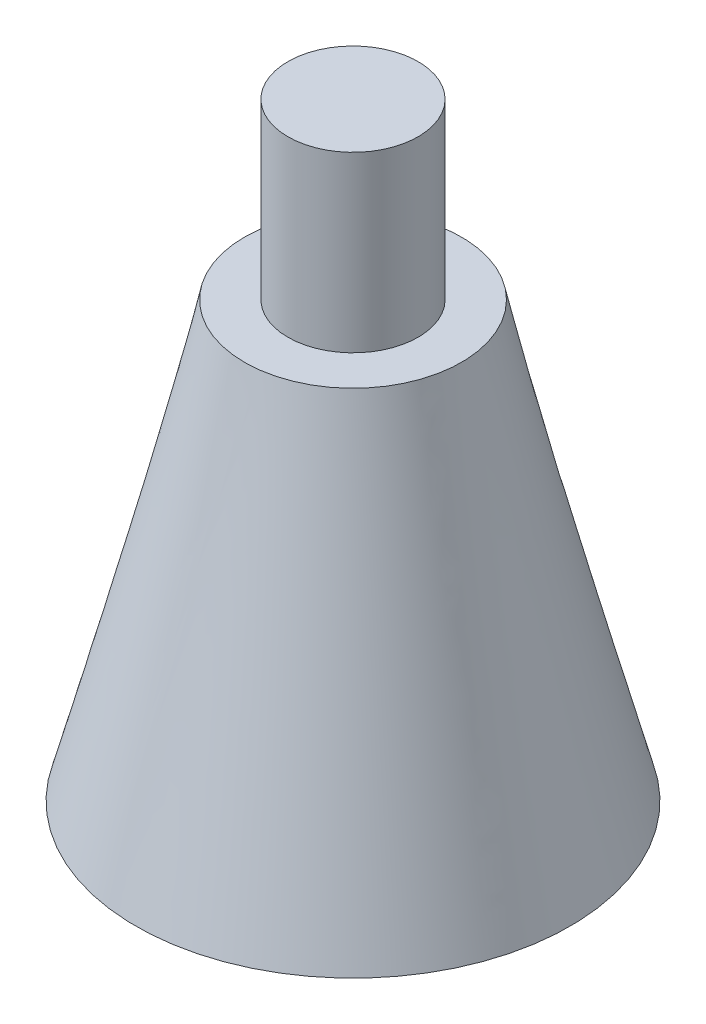
from build123d import *

# Parameters (mm, degrees)
SKETCH1_R           = 3
BOSS_EXTRUDE1_DEPTH = 8


with BuildPart() as part:
    # Sketch1 → Boss-Extrude1 (new body)
    with BuildSketch(Plane(origin=(0, 0, 0), x_dir=(1, 0, 0), z_dir=(0, 1, 0))):
        with Locations(Location((0, 0, 0), (0, 0, 270))):
            Circle(SKETCH1_R)
    extrude(amount=BOSS_EXTRUDE1_DEPTH)

    # Loft1: read off the stored shape, not the designer's step
    # Loft1: loft between two sections, ruled curve by curve
    loft1_from = [
        Edge.make_bspline([(0.685839691, 0, 4.952739032), (-9.219638372, 0, 6.324418414), (-10.591317755, 0, -3.581059649), (-0.685839691, 0, -4.952739032), (9.219638372, 0, -6.324418414), (10.591317755, 0, 3.581059649), (0.685839691, 0, 4.952739032)], [0, 0, 0, 0, 0.5, 0.5, 0.5, 1, 1, 1, 1], 3, [1, 0.333333333, 0.333333333, 1, 0.333333333, 0.333333333, 1]),
    ]
    loft1_to = [
        Edge.make_bspline([(-2.267193032, -20, 9.739601417), (-21.746395866, -20, 5.205215352), (-17.212009801, -20, -14.273987481), (2.267193032, -20, -9.739601417), (21.746395866, -20, -5.205215352), (17.212009801, -20, 14.273987481), (-2.267193032, -20, 9.739601417)], [0, 0, 0, 0, 0.5, 0.5, 0.5, 1, 1, 1, 1], 3, [1, 0.333333333, 0.333333333, 1, 0.333333333, 0.333333333, 1]),
    ]
    loft1 = Solid(Shell([*[Face.make_surface_from_curves(loft1_from[k], loft1_to[k]) for k in range(1)], Face(Wire(loft1_from)), Face(Wire(loft1_to))]))
    add(loft1)


solid = part.part
